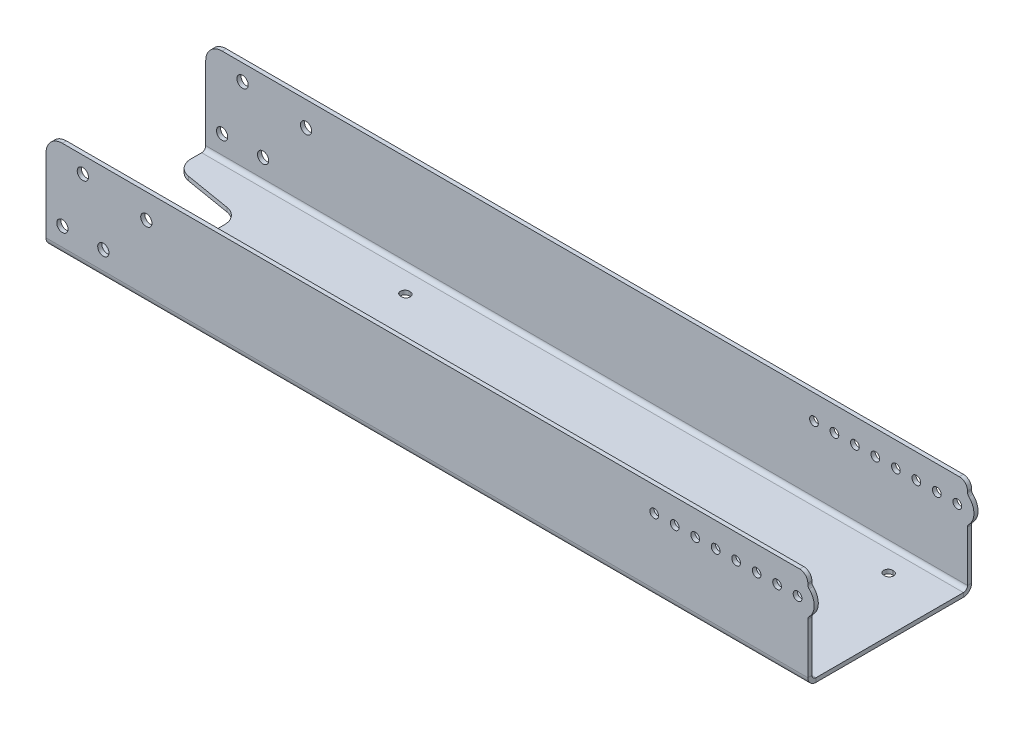
from build123d import *

# Parameters (mm, degrees)
SKETCH1_W                                 = 603.25
SKETCH1_H                                 = 127
BASE_FLANGE1_DEPTH                        = 3.175
EDGE_FLANGE1_STRIP_W                      = 19.05
EDGE_FLANGE1_STRIP_H                      = 3.175
EDGE_FLANGE1_STRIP_CUT_DEPTH              = 603.25
EDGE_FLANGE1_STRIP_2_W                    = 19.05
EDGE_FLANGE1_STRIP_2_H                    = 3.175
EDGE_FLANGE1_STRIP_CUT_2_DEPTH            = 603.25
EDGE_FLANGE1_DEPTH                        = 603.25
EDGE_FLANGE1_BEND_DEPTH                   = 603.25
F_1_4_CLEARANCE_HOLE1_D                   = 6.7564
HOLE_FOR_1_4_SELF_CLINCHING_NUTS_S_SS_C_D = 8.7376
CUT_EXTRUDE3_DEPTH                        = 336.319685151
FILLET1_R                                 = 6.35
HOLE_FOR_1_4_SELF_CLINCHING_NUTS_S_2_D    = 8.7376
CUT_EXTRUDE2_DEPTH                        = 318.515874603
FILLET3_R                                 = 12.7
FILLET4_R                                 = 12.7
F_1_4_START                               = -3.175
F_1_4_CLEARANCE_SLOT1_DEPTH               = 3.175
FILLET5_R                                 = 3.175


# Read off the part's stored shape, not the designer's step: 1/4 Clearance Slot1
# Sheet-metal steps are written as plain solids
with BuildPart() as part:
    # Sketch1 → Base-Flange1 (new body)
    with BuildSketch(Plane(origin=(0, 0, 0), x_dir=(1, 0, 0), z_dir=(0, 1, 0))):
        Rectangle(SKETCH1_W, SKETCH1_H)
    extrude(amount=-BASE_FLANGE1_DEPTH)

    # Edge-Flange1 strip (across the edge) → Edge-Flange1 strip cut (cut)
    with BuildSketch(Plane(origin=(301.625, 0, -63.5), x_dir=(0, 0, 1), z_dir=(-1, 0, 0))):
        with Locations((-3.175, -1.5875)):
            Rectangle(EDGE_FLANGE1_STRIP_W, EDGE_FLANGE1_STRIP_H)
    extrude(amount=EDGE_FLANGE1_STRIP_CUT_DEPTH, mode=Mode.SUBTRACT)

    # Edge-Flange1 strip 2 (across the edge) → Edge-Flange1 strip cut 2 (cut)
    with BuildSketch(Plane(origin=(-301.625, 0, 63.5), x_dir=(0, 0, -1), z_dir=(1, 0, 0))):
        with Locations((-3.175, -1.5875)):
            Rectangle(EDGE_FLANGE1_STRIP_2_W, EDGE_FLANGE1_STRIP_2_H)
    extrude(amount=EDGE_FLANGE1_STRIP_CUT_2_DEPTH, mode=Mode.SUBTRACT)

    # Edge-Flange1 section (across the edge) → Edge-Flange1 (add)
    with BuildSketch(Plane(origin=(301.625, 0, -63.5), x_dir=(0, 0, 1), z_dir=(-1, 0, 0))):
        with BuildLine():
            Line((0, 3.175), (0, 73.025))
            Line((0, 73.025), (3.175, 73.025))
            Line((3.175, 73.025), (3.175, 3.175))
            ThreePointArc((3.175, 3.175), (4.10493597, 0.92993597), (6.35, 0))
            Line((6.35, 0), (6.35, -3.175))
            ThreePointArc((6.35, -3.175), (1.859871939, -1.315128061), (0, 3.175))
        make_face()
    extrude(amount=EDGE_FLANGE1_DEPTH)

    # Edge-Flange1 section 2 (across the edge) → Edge-Flange1 bend (add)
    with BuildSketch(Plane(origin=(-301.625, 0, 63.5), x_dir=(0, 0, -1), z_dir=(1, 0, 0))):
        with BuildLine():
            Line((0, 3.175), (0, 73.025))
            Line((0, 73.025), (3.175, 73.025))
            Line((3.175, 73.025), (3.175, 3.175))
            ThreePointArc((3.175, 3.175), (4.10493597, 0.92993597), (6.35, 0))
            Line((6.35, 0), (6.35, -3.175))
            ThreePointArc((6.35, -3.175), (1.859871939, -1.315128061), (0, 3.175))
        make_face()
    extrude(amount=EDGE_FLANGE1_BEND_DEPTH)

    # 1/4 Clearance Hole1 (through all)
    with Locations(Plane.XY.offset(63.5)):
        with Locations((169.8625, 53.975), (185.7375, 53.975), (201.6125, 53.975), (217.4875, 53.975), (233.3625, 53.975), (249.2375, 53.975), (265.1125, 53.975), (280.9875, 53.975)):
            Hole(F_1_4_CLEARANCE_HOLE1_D / 2)

    # Hole for 1_4 Self-clinching Nuts _S_SS_C (through all)
    with Locations(Plane.XY.offset(63.5)):
        with Locations((-223.8375, 53.975)):
            Hole(HOLE_FOR_1_4_SELF_CLINCHING_NUTS_S_SS_C_D / 2)

    # Sketch33 → Cut-Extrude3 (cut, through all)
    with BuildSketch(Plane.XY.offset(63.5)):
        with BuildLine():
            Line((301.625, 73.025), (288.925, 73.025))
            Line((288.925, 73.025), (288.925, 64.147937825))
            ThreePointArc((288.925, 64.147937825), (293.8907, 53.975), (288.925, 43.802062175))
            Line((288.925, 43.802062175), (288.925, -3.175))
            Line((288.925, -3.175), (301.625, -3.175))
            Line((301.625, -3.175), (301.625, 73.025))
        make_face()
    extrude(amount=-CUT_EXTRUDE3_DEPTH, mode=Mode.SUBTRACT)

    # Fillet1
    fillet1_edges = [part.edges().sort_by_distance(p)[0] for p in [
        (288.925, 73.025, 61.9125),
        (288.925, 73.025, -61.9125),
    ]]
    fillet(fillet1_edges, radius=FILLET1_R)

    # Hole for 1_4 Self-clinching Nuts _S_ 2 (through all)
    with Locations(Plane.XY.offset(63.5)):
        with Locations((-273.05, 60.325), (-257.175, 17.4625), (-288.925, 17.4625)):
            Hole(HOLE_FOR_1_4_SELF_CLINCHING_NUTS_S_2_D / 2)

    # Sketch23 → Cut-Extrude2 (cut, through all)
    with BuildSketch(Plane.XZ.offset(3.175)):
        Polygon((-301.625, 38.1), (-244.475, 28.575), (-244.475, -28.575), (-301.625, -38.1), align=None)
    extrude(amount=-CUT_EXTRUDE2_DEPTH, mode=Mode.SUBTRACT)

    # Fillet3
    fillet3_edges = [part.edges().sort_by_distance(p)[0] for p in [
        (-301.625, -1.5875, -38.1),
        (-301.625, -1.5875, 38.1),
        (-244.475, -1.5875, 28.575),
        (-244.475, -1.5875, -28.575),
    ]]
    fillet(fillet3_edges, radius=FILLET3_R)

    # Fillet4
    fillet4_edges = [part.edges().sort_by_distance(p)[0] for p in [
        (-301.625, 73.025, -61.9125),
        (-301.625, 73.025, 61.9125),
    ]]
    fillet(fillet4_edges, radius=FILLET4_R)

    # 1/4 Clearance Slot1 outline → 1/4 Clearance Slot1 (cut)
    with BuildSketch(Plane(origin=(0, 0, 0), x_dir=(1, 0, 0), z_dir=(0, 1, 0)).offset(F_1_4_START)):
        with BuildLine():
            ThreePointArc((247.28805, -44.6532), (250.66625, -41.275), (247.28805, -37.8968))
            Line((247.28805, -37.8968), (246.42445, -37.8968))
            ThreePointArc((246.42445, -37.8968), (243.04625, -41.275), (246.42445, -44.6532))
            Line((246.42445, -44.6532), (247.28805, -44.6532))
        make_face()
        with BuildLine():
            ThreePointArc((-128.22555, -37.8968), (-131.60375, -41.275), (-128.22555, -44.6532))
            Line((-128.22555, -44.6532), (-127.36195, -44.6532))
            ThreePointArc((-127.36195, -44.6532), (-123.98375, -41.275), (-127.36195, -37.8968))
            Line((-127.36195, -37.8968), (-128.22555, -37.8968))
        make_face()
        with BuildLine():
            ThreePointArc((-127.36195, 37.8968), (-123.98375, 41.275), (-127.36195, 44.6532))
            Line((-127.36195, 44.6532), (-128.22555, 44.6532))
            ThreePointArc((-128.22555, 44.6532), (-131.60375, 41.275), (-128.22555, 37.8968))
            Line((-128.22555, 37.8968), (-127.36195, 37.8968))
        make_face()
        with BuildLine():
            ThreePointArc((246.42445, 44.6532), (243.04625, 41.275), (246.42445, 37.8968))
            Line((246.42445, 37.8968), (247.28805, 37.8968))
            ThreePointArc((247.28805, 37.8968), (250.66625, 41.275), (247.28805, 44.6532))
            Line((247.28805, 44.6532), (246.42445, 44.6532))
        make_face()
    extrude(amount=F_1_4_CLEARANCE_SLOT1_DEPTH, mode=Mode.SUBTRACT)

    # Fillet5
    fillet5_edges = [part.edges().sort_by_distance(p)[0] for p in [
        (288.925, 43.802062175, -61.9125),
        (288.925, 64.147937825, -61.9125),
        (288.925, 43.802062175, 61.9125),
        (288.925, 64.147937825, 61.9125),
    ]]
    fillet(fillet5_edges, radius=FILLET5_R)


solid = part.part
